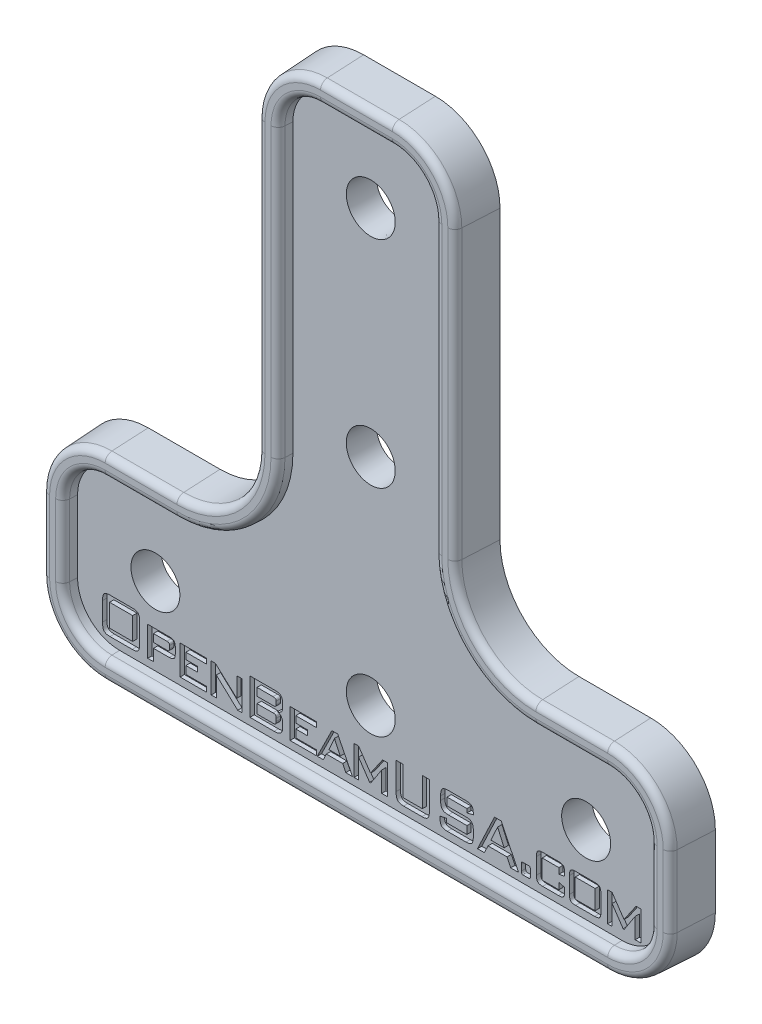
from build123d import *

# Parameters (mm, degrees)
BOSS_EXTRUDE1_DEPTH = 2
FILLET1_R           = 5
SKETCH2_R           = 1.6
CUT_EXTRUDE1_DEPTH  = 38.553295461
MOVE_FACE1_BY       = 0.5
MOVE_FACE1_2_BY     = 0.5
MOVE_FACE1_3_BY     = 0.5
MOVE_FACE1_4_BY     = 0.5
MOVE_FACE1_5_BY     = 0.5
MOVE_FACE1_6_BY     = 0.5
MOVE_FACE1_7_BY     = 0.5
MOVE_FACE1_8_BY     = 0.5
MOVE_FACE1_9_BY     = 0.5
MOVE_FACE1_10_BY    = 0.5
MOVE_FACE1_11_BY    = 0.5
MOVE_FACE1_12_BY    = 0.5
MOVE_FACE1_13_BY    = 0.5
MOVE_FACE1_14_BY    = 0.5
MOVE_FACE1_15_BY    = 0.5
MOVE_FACE1_16_BY    = 0.5
DRAFT1_ANGLE        = -3
BOSS_EXTRUDE3_DEPTH = 1
BOSS_EXTRUDE3_DRAFT = 3
FILLET3_R           = 0.5
CUT_EXTRUDE2_DEPTH  = 0.2
CUT_EXTRUDE2_DRAFT  = -3
SKETCH6_W           = 1.607142857
SKETCH6_H           = 1.5625
SKETCH6_W_2         = 1.383928571
SKETCH6_H_2         = 1.339285714
CUT_EXTRUDE3_DEPTH  = 0.3


with BuildPart() as part:
    # Sketch1 → Boss-Extrude1 (new body)
    with BuildSketch(Plane.XY):
        Polygon((-7.5, 30), (7.5, 30), (7.5, 0), (22.5, 0), (22.5, -15), (-22.5, -15), (-22.5, 0), (-7.5, 0), align=None)
    extrude(amount=BOSS_EXTRUDE1_DEPTH)

    # Fillet1
    fillet1_edges = [part.edges().sort_by_distance(p)[0] for p in [
        (22.5, -15, 1),
        (22.5, 0, 1),
        (-7.5, 0, 1),
        (7.5, 0, 1),
        (7.5, 30, 1),
        (-22.5, -15, 1),
        (-22.5, 0, 1),
        (-7.5, 30, 1),
    ]]
    fillet(fillet1_edges, radius=FILLET1_R)

    # Sketch2 → Cut-Extrude1 (cut, through all)
    with BuildSketch(Plane.XY.offset(2)):
        with Locations((-15, -7.5)):
            Circle(SKETCH2_R)
        with Locations((0, -7.5)):
            Circle(SKETCH2_R)
        with Locations((15, -7.5)):
            Circle(SKETCH2_R)
        with Locations((0, 22.5)):
            Circle(SKETCH2_R)
        with Locations((0, 7.5)):
            Circle(SKETCH2_R)
    extrude(amount=-CUT_EXTRUDE1_DEPTH, mode=Mode.SUBTRACT)

    # Move Face1: a curved face moved inward by 0.5
    add(Solid.thicken(part.faces().sort_by_distance((-8.964466094, 1.464466094, 1))[0], -MOVE_FACE1_BY), mode=Mode.SUBTRACT)

    # Move Face1 2: a face moved inward by 0.5
    extrude(part.faces().sort_by_distance((-15, 0, 1))[0], amount=MOVE_FACE1_2_BY, dir=(0, -1, 0), mode=Mode.SUBTRACT)

    # Move Face1 3: a curved face moved inward by 0.5
    add(Solid.thicken(part.faces().sort_by_distance((-21.035533906, -1.464466094, 1))[0], -MOVE_FACE1_3_BY), mode=Mode.SUBTRACT)

    # Move Face1 4: a face moved inward by 0.5
    extrude(part.faces().sort_by_distance((-22.5, -7.5, 1))[0], amount=MOVE_FACE1_4_BY, dir=(1, 0, 0), mode=Mode.SUBTRACT)

    # Move Face1 5: a curved face moved inward by 0.5
    add(Solid.thicken(part.faces().sort_by_distance((-21.035533906, -13.535533906, 1))[0], -MOVE_FACE1_5_BY), mode=Mode.SUBTRACT)

    # Move Face1 6: a face moved inward by 0.5
    extrude(part.faces().sort_by_distance((0, -15, 1))[0], amount=MOVE_FACE1_6_BY, dir=(0, 1, 0), mode=Mode.SUBTRACT)

    # Move Face1 7: a curved face moved inward by 0.5
    add(Solid.thicken(part.faces().sort_by_distance((21.035533906, -13.535533906, 1))[0], -MOVE_FACE1_7_BY), mode=Mode.SUBTRACT)

    # Move Face1 8: a face moved inward by 0.5
    extrude(part.faces().sort_by_distance((22.5, -7.5, 1))[0], amount=MOVE_FACE1_8_BY, dir=(-1, 0, 0), mode=Mode.SUBTRACT)

    # Move Face1 9: a curved face moved inward by 0.5
    add(Solid.thicken(part.faces().sort_by_distance((21.035533906, -1.464466094, 1))[0], -MOVE_FACE1_9_BY), mode=Mode.SUBTRACT)

    # Move Face1 10: a face moved inward by 0.5
    extrude(part.faces().sort_by_distance((15, 0, 1))[0], amount=MOVE_FACE1_10_BY, dir=(0, -1, 0), mode=Mode.SUBTRACT)

    # Move Face1 11: a curved face moved inward by 0.5
    add(Solid.thicken(part.faces().sort_by_distance((8.964466094, 1.464466094, 1))[0], -MOVE_FACE1_11_BY), mode=Mode.SUBTRACT)

    # Move Face1 12: a face moved inward by 0.5
    extrude(part.faces().sort_by_distance((7.5, 15, 1))[0], amount=MOVE_FACE1_12_BY, dir=(-1, 0, 0), mode=Mode.SUBTRACT)

    # Move Face1 13: a curved face moved inward by 0.5
    add(Solid.thicken(part.faces().sort_by_distance((6.035533906, 28.535533906, 1))[0], -MOVE_FACE1_13_BY), mode=Mode.SUBTRACT)

    # Move Face1 14: a face moved inward by 0.5
    extrude(part.faces().sort_by_distance((0, 30, 1))[0], amount=MOVE_FACE1_14_BY, dir=(0, -1, 0), mode=Mode.SUBTRACT)

    # Move Face1 15: a curved face moved inward by 0.5
    add(Solid.thicken(part.faces().sort_by_distance((-6.035533906, 28.535533906, 1))[0], -MOVE_FACE1_15_BY), mode=Mode.SUBTRACT)

    # Move Face1 16: a face moved inward by 0.5
    extrude(part.faces().sort_by_distance((-7.5, 15, 1))[0], amount=MOVE_FACE1_16_BY, dir=(1, 0, 0), mode=Mode.SUBTRACT)

    # Draft1
    draft1_faces = [part.faces().sort_by_distance(p)[0] for p in [
        (13.4, -7.5, 1),
        (-1.6, 22.5, 1),
        (-1.6, 7.5, 1),
        (-1.6, -7.5, 1),
        (-16.6, -7.5, 1),
        (-20.681980515, -1.818019485, 1),
        (-22, -7.5, 1),
        (-20.681980515, -13.181980515, 1),
        (0, -14.5, 1),
        (20.681980515, -13.181980515, 1),
        (22, -7.5, 1),
        (20.681980515, -1.818019485, 1),
        (15, -0.5, 1),
        (8.610912703, 1.110912703, 1),
        (7, 15, 1),
        (5.681980515, 28.181980515, 1),
        (0, 29.5, 1),
        (-5.681980515, 28.181980515, 1),
        (-7, 15, 1),
        (-8.610912703, 1.110912703, 1),
        (-15, -0.5, 1),
    ]]
    draft(draft1_faces, Plane(origin=(0, 0, 0), x_dir=(-1, 0, 0), z_dir=(0, 0, -1)), DRAFT1_ANGLE)


with BuildPart() as boss_extrude3_tool:
    # Sketch4 → Boss-Extrude3 (with draft: the straight prism first)
    with BuildSketch(Plane.XY.offset(2)):
        with BuildLine():
            Line((-17.5, -14.395184441), (17.5, -14.395184441))
            ThreePointArc((17.5, -14.395184441), (20.607864723, -13.107864723), (21.895184441, -10))
            Line((21.895184441, -10), (21.895184441, -5))
            ThreePointArc((21.895184441, -5), (20.607864723, -1.892135277), (17.5, -0.604815559))
            Line((17.5, -0.604815559), (12.5, -0.604815559))
            ThreePointArc((12.5, -0.604815559), (8.536796911, 1.036796911), (6.895184441, 5))
            Line((6.895184441, 5), (6.895184441, 25))
            ThreePointArc((6.895184441, 25), (5.607864723, 28.107864723), (2.5, 29.395184441))
            Line((2.5, 29.395184441), (-2.5, 29.395184441))
            ThreePointArc((-2.5, 29.395184441), (-5.607864723, 28.107864723), (-6.895184441, 25))
            Line((-6.895184441, 25), (-6.895184441, 5))
            ThreePointArc((-6.895184441, 5), (-8.536796911, 1.036796911), (-12.5, -0.604815559))
            Line((-12.5, -0.604815559), (-17.5, -0.604815559))
            ThreePointArc((-17.5, -0.604815559), (-20.607864723, -1.892135277), (-21.895184441, -5))
            Line((-21.895184441, -5), (-21.895184441, -10))
            ThreePointArc((-21.895184441, -10), (-20.607864723, -13.107864723), (-17.5, -14.395184441))
        make_face()
        with BuildLine():
            Line((-17.5, -12.921388331), (17.5, -12.921388331))
            ThreePointArc((17.5, -12.921388331), (19.565733499, -12.065733499), (20.421388331, -10))
            Line((20.421388331, -10), (20.421388331, -5))
            ThreePointArc((20.421388331, -5), (19.565733499, -2.934266501), (17.5, -2.078611669))
            Line((17.5, -2.078611669), (12.5, -2.078611669))
            ThreePointArc((12.5, -2.078611669), (7.494665688, -0.005334312), (5.421388331, 5))
            Line((5.421388331, 5), (5.421388331, 25))
            ThreePointArc((5.421388331, 25), (4.565733499, 27.065733499), (2.5, 27.921388331))
            Line((2.5, 27.921388331), (-2.5, 27.921388331))
            ThreePointArc((-2.5, 27.921388331), (-4.565733499, 27.065733499), (-5.421388331, 25))
            Line((-5.421388331, 25), (-5.421388331, 5))
            ThreePointArc((-5.421388331, 5), (-7.494665688, -0.005334312), (-12.5, -2.078611669))
            Line((-12.5, -2.078611669), (-17.5, -2.078611669))
            ThreePointArc((-17.5, -2.078611669), (-19.565733499, -2.934266501), (-20.421388331, -5))
            Line((-20.421388331, -5), (-20.421388331, -10))
            ThreePointArc((-20.421388331, -10), (-19.565733499, -12.065733499), (-17.5, -12.921388331))
        make_face(mode=Mode.SUBTRACT)
    extrude(amount=BOSS_EXTRUDE3_DEPTH)
    # Boss-Extrude3: the draft: its side faces are tilted about the plane it starts from
    boss_extrude3_sides = [boss_extrude3_tool.faces().sort_by_distance(p)[0] for p in [
        (-20.607864723, -1.892135277, 2.5),
        (-21.895184441, -7.5, 2.5),
        (-20.607864723, -13.107864723, 2.5),
        (0, -14.395184441, 2.5),
        (20.607864723, -13.107864723, 2.5),
        (21.895184441, -7.5, 2.5),
        (20.607864723, -1.892135277, 2.5),
        (15, -0.604815559, 2.5),
        (8.536796911, 1.036796911, 2.5),
        (6.895184441, 15, 2.5),
        (5.607864723, 28.107864723, 2.5),
        (0, 29.395184441, 2.5),
        (-5.607864723, 28.107864723, 2.5),
        (-6.895184441, 15, 2.5),
        (-8.536796911, 1.036796911, 2.5),
        (-15, -0.604815559, 2.5),
        (-15, -2.078611669, 2.5),
        (-7.494665688, -0.005334312, 2.5),
        (-5.421388331, 15, 2.5),
        (-4.565733499, 27.065733499, 2.5),
        (0, 27.921388331, 2.5),
        (4.565733499, 27.065733499, 2.5),
        (5.421388331, 15, 2.5),
        (7.494665688, -0.005334312, 2.5),
        (15, -2.078611669, 2.5),
        (19.565733499, -2.934266501, 2.5),
        (20.421388331, -7.5, 2.5),
        (19.565733499, -12.065733499, 2.5),
        (0, -12.921388331, 2.5),
        (-19.565733499, -12.065733499, 2.5),
        (-20.421388331, -7.5, 2.5),
        (-19.565733499, -2.934266501, 2.5),
    ]]
    draft(boss_extrude3_sides, Plane.XY.offset(2), BOSS_EXTRUDE3_DRAFT)


with BuildPart() as part_1:
    add(part.part)

    # Boss-Extrude3: add boss_extrude3_tool
    add(boss_extrude3_tool.part)

    # Fillet3
    fillet3_edges = [part_1.edges().sort_by_distance(p)[0] for p in [
        (-7.531723584, 0.031723584, 3),
        (-5.47379611, 15, 3),
        (-4.602791396, 27.102791396, 3),
        (0, 27.97379611, 3),
        (4.602791396, 27.102791396, 3),
        (5.47379611, 15, 3),
        (7.531723584, 0.031723584, 3),
        (15, -2.02620389, 3),
        (19.602791396, -2.897208604, 3),
        (20.47379611, -7.5, 3),
        (19.602791396, -12.102791396, 3),
        (0, -12.97379611, 3),
        (-19.602791396, -12.102791396, 3),
        (-20.47379611, -7.5, 3),
        (-19.602791396, -2.897208604, 3),
        (-8.499739015, 0.999739015, 3),
        (-6.842776662, 15, 3),
        (-5.570806827, 28.070806827, 3),
        (0, 29.342776662, 3),
        (5.570806827, 28.070806827, 3),
        (6.842776662, 15, 3),
        (8.499739015, 0.999739015, 3),
        (15, -0.657223338, 3),
        (20.570806827, -1.929193173, 3),
        (21.842776662, -7.5, 3),
        (20.570806827, -13.070806827, 3),
        (0, -14.342776662, 3),
        (-20.570806827, -13.070806827, 3),
        (-21.842776662, -7.5, 3),
        (-20.570806827, -1.929193173, 3),
        (-15, -2.02620389, 3),
        (-15, -0.657223338, 3),
    ]]
    fillet(fillet3_edges, radius=FILLET3_R)


with BuildPart() as cut_extrude2_tool:
    # Sketch5 → Cut-Extrude2 (with draft: the straight prism first)
    with BuildSketch(Plane(origin=(0, 0, 0), x_dir=(-1, 0, 0), z_dir=(0, 0, -1))):
        with BuildLine():
            Line((-14.5, -13.8), (14.5, -13.8))
            ThreePointArc((14.5, -13.8), (14.853553391, -13.653553391), (15, -13.3))
            Line((15, -13.3), (15, -10.3))
            ThreePointArc((15, -10.3), (14.853553391, -9.946446609), (14.5, -9.8))
            Line((14.5, -9.8), (-14.5, -9.8))
            ThreePointArc((-14.5, -9.8), (-14.853553391, -9.946446609), (-15, -10.3))
            Line((-15, -10.3), (-15, -13.3))
            ThreePointArc((-15, -13.3), (-14.853553391, -13.653553391), (-14.5, -13.8))
        make_face()
    extrude(amount=-CUT_EXTRUDE2_DEPTH)
    # Cut-Extrude2: the draft: its side faces are tilted about the plane it starts from
    cut_extrude2_sides = [cut_extrude2_tool.faces().sort_by_distance(p)[0] for p in [
        (0, -13.8, 0.1),
        (-14.853553391, -13.653553391, 0.1),
        (-15, -11.8, 0.1),
        (-14.853553391, -9.946446609, 0.1),
        (0, -9.8, 0.1),
        (14.853553391, -9.946446609, 0.1),
        (15, -11.8, 0.1),
        (14.853553391, -13.653553391, 0.1),
    ]]
    draft(cut_extrude2_sides, Plane(origin=(0, 0, 0), x_dir=(-1, 0, 0), z_dir=(0, 0, -1)), CUT_EXTRUDE2_DRAFT)


with BuildPart() as part_2:
    add(part_1.part)

    # Cut-Extrude2: cut by cut_extrude2_tool
    add(cut_extrude2_tool.part, mode=Mode.SUBTRACT)

    # Sketch6 → Cut-Extrude3 (cut)
    # profile 1 of 15: a face of its own
    with BuildSketch(Plane.XY.offset(2)):
        with BuildLine():
            add(Edge.make_bspline(
                [(-18.683035714, -10.51011601), (-18.682938002, -10.482896819), (-18.682750693, -10.430719031), (-18.676668044, -10.356042819), (-18.668860697, -10.287926096), (-18.656684431, -10.226526586), (-18.643031263, -10.171215857), (-18.623628363, -10.123356935), (-18.602261682, -10.081592118), (-18.57683028, -10.045679654), (-18.545847467, -10.01549167), (-18.508789269, -9.990400409), (-18.46597857, -9.968617372), (-18.416580048, -9.951568957), (-18.361320255, -9.937537726), (-18.299893333, -9.928095322), (-18.232289845, -9.922620499), (-18.185232384, -9.921811984), (-18.160574777, -9.921388331)],
                knots=[0, 0, 0, 0, 1.403573437, 2.690578007, 3.862923789, 4.937964027, 5.918444779, 6.796020214, 7.595440406, 8.334448064, 9.055422419, 9.814027648, 10.634759978, 11.526322857, 12.50379092, 13.57259004, 14.728063101, 16, 16, 16, 16], degree=3))
            Line((-18.160574777, -9.921388331), (-16.618303571, -9.921388331))
            add(Edge.make_bspline(
                [(-16.618303571, -9.921388331), (-16.593646851, -9.921821445), (-16.546359359, -9.922652086), (-16.47851397, -9.928042886), (-16.416866585, -9.937552288), (-16.361581808, -9.951531158), (-16.312067564, -9.968807094), (-16.268818434, -9.990195221), (-16.231663242, -10.015520924), (-16.200589368, -10.045644028), (-16.175401388, -10.081803336), (-16.152770043, -10.122971899), (-16.134936302, -10.1715459), (-16.119750579, -10.226353255), (-16.108035577, -10.28796068), (-16.100083866, -10.356032245), (-16.094044728, -10.430722068), (-16.09385104, -10.48289786), (-16.09375, -10.51011601)],
                knots=[0, 0, 0, 0, 1.269785572, 2.435237667, 3.502229043, 4.478043838, 5.368098746, 6.198135559, 6.9554577, 7.675212615, 8.41297033, 9.216677895, 10.088421144, 11.070387939, 12.143609877, 13.313972779, 14.598800537, 16, 16, 16, 16], degree=3))
            Line((-16.09375, -10.51011601), (-16.09375, -11.811036769))
            add(Edge.make_bspline(
                [(-16.09375, -11.811036769), (-16.093842278, -11.839417739), (-16.09401872, -11.893684241), (-16.100160957, -11.971615929), (-16.107923834, -12.042494992), (-16.119768025, -12.106636793), (-16.134983627, -12.163512713), (-16.152647685, -12.213987832), (-16.175226782, -12.256626432), (-16.200584268, -12.293600425), (-16.231614851, -12.324447097), (-16.268765478, -12.35050105), (-16.312034652, -12.372539497), (-16.361440049, -12.390711436), (-16.416882029, -12.404519647), (-16.478547615, -12.413833116), (-16.546317858, -12.420380788), (-16.593639586, -12.421043123), (-16.618303571, -12.421388331)],
                knots=[0, 0, 0, 0, 1.431764632, 2.737639174, 3.942781974, 5.02906717, 6.025299976, 6.912532689, 7.72083079, 8.453349384, 9.16691991, 9.91579719, 10.734504626, 11.610727997, 12.566975227, 13.612570717, 14.755676853, 16, 16, 16, 16], degree=3))
            Line((-16.618303571, -12.421388331), (-18.160574777, -12.421388331))
            add(Edge.make_bspline(
                [(-18.160574777, -12.421388331), (-18.185239843, -12.421053786), (-18.232332055, -12.420415051), (-18.299858951, -12.413778337), (-18.36130513, -12.404534983), (-18.416721056, -12.39067324), (-18.466016648, -12.372733543), (-18.508837175, -12.350292386), (-18.545896228, -12.324476536), (-18.576835987, -12.293565989), (-18.602437267, -12.256831275), (-18.623739569, -12.213611433), (-18.642993476, -12.163833364), (-18.656664691, -12.106469119), (-18.668974999, -12.042529082), (-18.676590443, -11.971605588), (-18.682776858, -11.893687213), (-18.682946824, -11.83941876), (-18.683035714, -11.811036769)],
                knots=[0, 0, 0, 0, 1.246375741, 2.37966474, 3.42698501, 4.384809634, 5.262478393, 6.072109836, 6.82222244, 7.536970048, 8.27069698, 9.074935671, 9.967741802, 10.962637047, 12.050714143, 13.257844907, 14.565873577, 16, 16, 16, 16], degree=3))
            Line((-18.683035714, -11.811036769), (-18.683035714, -10.51011601))
        make_face()
        with Locations((-17.388392858, -11.149066903)):
            Rectangle(SKETCH6_W, SKETCH6_H, mode=Mode.SUBTRACT)
    # profile 2 of 15: a face of its own
    with BuildSketch(Plane.XY.offset(2)):
        with BuildLine():
            Line((-15.535714286, -12.421388331), (-15.535714286, -10.367816903))
            Line((-15.535714286, -10.367816903), (-14.029715402, -10.367816903))
            add(Edge.make_bspline(
                [(-14.029715402, -10.367816903), (-13.995423097, -10.368539056), (-13.931618582, -10.369882701), (-13.843548193, -10.388389773), (-13.76975323, -10.416602804), (-13.710808728, -10.459570634), (-13.666606985, -10.516609772), (-13.63694694, -10.588263693), (-13.619168575, -10.67387452), (-13.617150642, -10.735791272), (-13.616071429, -10.768905072)],
                knots=[0, 0, 0, 0, 1.229947315, 2.288449038, 3.21776736, 4.048244043, 4.875520742, 5.777278643, 6.811262717, 8, 8, 8, 8], degree=3))
            Line((-13.616071429, -10.768905072), (-13.616071429, -11.216728733))
            add(Edge.make_bspline(
                [(-13.616071429, -11.216728733), (-13.61713941, -11.249840567), (-13.619129003, -11.311526162), (-13.637004149, -11.397243648), (-13.667259143, -11.468686782), (-13.711509006, -11.52635012), (-13.770938209, -11.568616699), (-13.844372756, -11.597454165), (-13.932113653, -11.615653184), (-13.995666115, -11.617062069), (-14.029715402, -11.617816903)],
                knots=[0, 0, 0, 0, 1.189703839, 2.216355318, 3.129857055, 3.957806409, 4.795702339, 5.718039216, 6.7774016, 8, 8, 8, 8], degree=3))
            Line((-14.029715402, -11.617816903), (-15.133928571, -11.617816903))
            Line((-15.133928571, -11.617816903), (-15.133928571, -12.421388331))
            Line((-15.133928571, -12.421388331), (-15.535714286, -12.421388331))
        make_face()
        with BuildLine():
            Line((-14.203404018, -10.72495976), (-15.133928571, -10.72495976))
            Line((-15.133928571, -10.72495976), (-15.133928571, -11.260674045))
            Line((-15.133928571, -11.260674045), (-14.203404018, -11.260674045))
            add(Edge.make_bspline(
                [(-14.203404018, -11.260674045), (-14.187098835, -11.260411914), (-14.157096885, -11.259929586), (-14.115874448, -11.253123203), (-14.082698889, -11.241865943), (-14.056496441, -11.22503593), (-14.038862603, -11.201230006), (-14.025790126, -11.172314024), (-14.019621299, -11.136752914), (-14.018473493, -11.11118051), (-14.017857143, -11.097448599)],
                knots=[0, 0, 0, 0, 1.352116432, 2.487928597, 3.45245427, 4.244622693, 5.028283095, 5.874769735, 6.858790467, 8, 8, 8, 8], degree=3))
            Line((-14.017857143, -11.097448599), (-14.017857143, -10.888185206))
            add(Edge.make_bspline(
                [(-14.017857143, -10.888185206), (-14.018466943, -10.874447349), (-14.01960255, -10.848863871), (-14.025849613, -10.813373783), (-14.038604854, -10.784405633), (-14.05696494, -10.76134583), (-14.082395639, -10.743581231), (-14.115935147, -10.732589069), (-14.157077073, -10.725678609), (-14.187091859, -10.725212873), (-14.203404018, -10.72495976)],
                knots=[0, 0, 0, 0, 1.141800926, 2.126331593, 2.973256896, 3.742199929, 4.545756613, 5.510782118, 6.64718288, 8, 8, 8, 8], degree=3))
        make_face(mode=Mode.SUBTRACT)
    # profile 3 of 15: a face of its own
    with BuildSketch(Plane.XY.offset(2)):
        Polygon((-13.28125, -12.421388331), (-13.28125, -10.367816903), (-11.450892857, -10.367816903), (-11.450892857, -10.72495976), (-12.879464286, -10.72495976), (-12.879464286, -11.171388331), (-12.075892857, -11.171388331), (-12.075892857, -11.528531188), (-12.879464286, -11.528531188), (-12.879464286, -12.064245474), (-11.450892857, -12.064245474), (-11.450892857, -12.421388331), align=None)
    # profile 4 of 15: a face of its own
    with BuildSketch(Plane.XY.offset(2)):
        Polygon((-11.116071429, -12.421388331), (-11.116071429, -10.367816903), (-10.821707589, -10.367816903), (-9.330357143, -11.731516679), (-9.330357143, -10.367816903), (-8.973214286, -10.367816903), (-8.973214286, -12.421388331), (-9.269670759, -12.421388331), (-10.758928571, -11.036762215), (-10.758928571, -12.421388331), align=None)
    # profile 5 of 15: a face of its own
    with BuildSketch(Plane.XY.offset(2)):
        with BuildLine():
            Line((-8.415178571, -12.421388331), (-8.415178571, -9.921388331))
            Line((-8.415178571, -9.921388331), (-6.604352679, -9.921388331))
            add(Edge.make_bspline(
                [(-6.604352679, -9.921388331), (-6.584578843, -9.921834875), (-6.546344475, -9.922698306), (-6.490993159, -9.928039701), (-6.439967327, -9.937982556), (-6.392984602, -9.950745963), (-6.350485334, -9.96859511), (-6.312122888, -9.989884555), (-6.278270641, -10.015636971), (-6.247499297, -10.044225626), (-6.221859971, -10.078333565), (-6.199342826, -10.116212883), (-6.180626562, -10.158719559), (-6.16430305, -10.205449169), (-6.152784019, -10.257462736), (-6.1448266, -10.313921043), (-6.13872257, -10.37466268), (-6.138505034, -10.416628349), (-6.138392857, -10.438268911)],
                knots=[0, 0, 0, 0, 1.179053587, 2.27979888, 3.310209753, 4.275627239, 5.176695408, 6.051906754, 6.883661987, 7.707291014, 8.547436998, 9.417583548, 10.329674368, 11.311670144, 12.364223081, 13.499348066, 14.710481303, 16, 16, 16, 16], degree=3))
            Line((-6.138392857, -10.438268911), (-6.138392857, -10.712403956))
            add(Edge.make_bspline(
                [(-6.138392857, -10.712403956), (-6.139201585, -10.740664602), (-6.140751158, -10.794813763), (-6.159801787, -10.871364096), (-6.188653758, -10.939999278), (-6.231476997, -10.9984646), (-6.284875183, -11.04779488), (-6.349361396, -11.086101447), (-6.424010981, -11.11446387), (-6.477873721, -11.124365422), (-6.505998884, -11.129535653)],
                knots=[0, 0, 0, 0, 1.098733523, 2.105242008, 3.054667811, 3.982622784, 4.906010345, 5.869427447, 6.887492557, 8, 8, 8, 8], degree=3))
            add(Edge.make_bspline(
                [(-6.505998884, -11.129535653), (-6.478036354, -11.135503517), (-6.424069928, -11.147021228), (-6.349494996, -11.180530422), (-6.285840082, -11.227562783), (-6.231981261, -11.286146859), (-6.190215279, -11.356411535), (-6.158931917, -11.436113578), (-6.142041656, -11.526206522), (-6.139644104, -11.589151907), (-6.138392857, -11.62200217)],
                knots=[0, 0, 0, 0, 1.013460027, 1.955932307, 2.877588656, 3.806945104, 4.76292404, 5.764334755, 6.833239427, 8, 8, 8, 8], degree=3))
            Line((-6.138392857, -11.62200217), (-6.138392857, -11.935199715))
            add(Edge.make_bspline(
                [(-6.138392857, -11.935199715), (-6.138719134, -11.95521589), (-6.1393511, -11.993985259), (-6.146352988, -12.050089823), (-6.158290901, -12.101885834), (-6.174184983, -12.150022339), (-6.195462804, -12.19402501), (-6.220131016, -12.234909748), (-6.250938229, -12.270878361), (-6.285794672, -12.303013122), (-6.32562112, -12.331371608), (-6.370173139, -12.355556185), (-6.41960395, -12.375811734), (-6.47355595, -12.392422759), (-6.532276629, -12.405800235), (-6.595779264, -12.414401622), (-6.66400309, -12.420183393), (-6.71106383, -12.420976607), (-6.735491071, -12.421388331)],
                knots=[0, 0, 0, 0, 1.08782081, 2.107002258, 3.066832627, 3.974287218, 4.856380914, 5.719335199, 6.562621095, 7.421491684, 8.291454475, 9.213583009, 10.171413382, 11.190986747, 12.279688622, 13.441734262, 14.672112383, 16, 16, 16, 16], degree=3))
            Line((-6.735491071, -12.421388331), (-8.415178571, -12.421388331))
        make_face()
        with BuildLine():
            Line((-6.809430804, -10.367816903), (-7.924107143, -10.367816903))
            Line((-7.924107143, -10.367816903), (-7.924107143, -10.903531188))
            Line((-7.924107143, -10.903531188), (-6.809430804, -10.903531188))
            add(Edge.make_bspline(
                [(-6.809430804, -10.903531188), (-6.789868986, -10.903287406), (-6.753850642, -10.902838541), (-6.704705771, -10.895868934), (-6.664727575, -10.885532078), (-6.633451466, -10.869144346), (-6.610525171, -10.846199776), (-6.594844818, -10.816925235), (-6.585991347, -10.781273052), (-6.585228551, -10.755471654), (-6.584821429, -10.741700831)],
                knots=[0, 0, 0, 0, 1.458061766, 2.684667078, 3.694961047, 4.525618309, 5.286113602, 6.078010599, 6.974188284, 8, 8, 8, 8], degree=3))
            Line((-6.584821429, -10.741700831), (-6.584821429, -10.52964726))
            add(Edge.make_bspline(
                [(-6.584821429, -10.52964726), (-6.585215601, -10.516102183), (-6.585953486, -10.490746024), (-6.594997769, -10.455637651), (-6.610492176, -10.426504554), (-6.633624093, -10.40365479), (-6.664600507, -10.386469448), (-6.704601516, -10.375280427), (-6.753863487, -10.36857796), (-6.789873506, -10.368084762), (-6.809430804, -10.367816903)],
                knots=[0, 0, 0, 0, 1.011123078, 1.892805606, 2.686758123, 3.449227428, 4.290532683, 5.308364354, 6.538153555, 8, 8, 8, 8], degree=3))
        make_face(mode=Mode.SUBTRACT)
        with BuildLine():
            Line((-6.809430804, -11.34995976), (-7.924107143, -11.34995976))
            Line((-7.924107143, -11.34995976), (-7.924107143, -11.97495976))
            Line((-7.924107143, -11.97495976), (-6.809430804, -11.97495976))
            add(Edge.make_bspline(
                [(-6.809430804, -11.97495976), (-6.78912971, -11.974729537), (-6.751959866, -11.974308016), (-6.701848603, -11.964050408), (-6.661008099, -11.950556293), (-6.630050641, -11.927619568), (-6.609123919, -11.895827935), (-6.594863374, -11.856463039), (-6.585878103, -11.808409349), (-6.585191715, -11.773414396), (-6.584821429, -11.754535653)],
                knots=[0, 0, 0, 0, 1.312342557, 2.402804986, 3.304020979, 4.078546667, 4.847629795, 5.734752509, 6.777965855, 8, 8, 8, 8], degree=3))
            Line((-6.584821429, -11.754535653), (-6.584821429, -11.568291233))
            add(Edge.make_bspline(
                [(-6.584821429, -11.568291233), (-6.585200764, -11.549416114), (-6.585903926, -11.514427881), (-6.594743125, -11.466546068), (-6.609130884, -11.427679287), (-6.630070466, -11.396444881), (-6.661397726, -11.374656265), (-6.701546197, -11.359680216), (-6.752105393, -11.35100656), (-6.789165763, -11.350329813), (-6.809430804, -11.34995976)],
                knots=[0, 0, 0, 0, 1.227068129, 2.274578833, 3.151237288, 3.911086288, 4.679771909, 5.590123259, 6.682251448, 8, 8, 8, 8], degree=3))
        make_face(mode=Mode.SUBTRACT)
    # profile 6 of 15: a face of its own
    with BuildSketch(Plane.XY.offset(2)):
        Polygon((-5.625, -12.421388331), (-5.625, -10.367816903), (-3.794642857, -10.367816903), (-3.794642857, -10.72495976), (-5.223214286, -10.72495976), (-5.223214286, -11.171388331), (-4.419642857, -11.171388331), (-4.419642857, -11.528531188), (-5.223214286, -11.528531188), (-5.223214286, -12.064245474), (-3.794642857, -12.064245474), (-3.794642857, -12.421388331), align=None)
    # profile 7 of 15: a face of its own
    with BuildSketch(Plane.XY.offset(2)):
        Polygon((-3.727678571, -12.421388331), (-2.709263393, -10.367816903), (-2.306780134, -10.367816903), (-1.272321429, -12.421388331), (-1.741768973, -12.421388331), (-1.958007812, -11.97495976), (-3.093610491, -11.97495976), (-3.30984933, -12.421388331), align=None)
        Polygon((-2.915039062, -11.617816903), (-2.128208705, -11.617816903), (-2.52859933, -10.746583644), align=None, mode=Mode.SUBTRACT)
    # profile 8 of 15: a face of its own
    with BuildSketch(Plane.XY.offset(2)):
        Polygon((-1.160714286, -12.421388331), (-1.160714286, -10.367816903), (-0.848214286, -10.367816903), (-0.017438616, -11.586427394), (0.822405134, -10.367816903), (1.160714286, -10.367816903), (1.160714286, -12.421388331), (0.758928571, -12.421388331), (0.758928571, -11.008162885), (0.000697545, -12.174457528), (-0.080217634, -12.174457528), (-0.848214286, -11.040947483), (-0.848214286, -12.421388331), align=None)
    # profile 9 of 15: a face of its own
    with BuildSketch(Plane.XY.offset(2)):
        with BuildLine():
            Line((2.254464286, -9.921388331), (2.254464286, -11.930316903))
            Line((2.254464286, -11.930316903), (3.59375, -11.930316903))
            Line((3.59375, -11.930316903), (3.59375, -9.921388331))
            Line((3.59375, -9.921388331), (4.084821429, -9.921388331))
            Line((4.084821429, -9.921388331), (4.084821429, -11.811036769))
            add(Edge.make_bspline(
                [(4.084821429, -11.811036769), (4.084729151, -11.83941774), (4.08455271, -11.893684242), (4.078410469, -11.971615924), (4.070647603, -12.042495008), (4.058803376, -12.106636741), (4.043587889, -12.163512882), (4.025923466, -12.213987296), (4.003345545, -12.256628171), (3.977984177, -12.293594652), (3.946967658, -12.32446853), (3.909930317, -12.35029481), (3.867103299, -12.37273261), (3.817809766, -12.390674382), (3.762392801, -12.404530974), (3.700719574, -12.413829665), (3.632951625, -12.420381775), (3.585629562, -12.421043461), (3.560965402, -12.421388331)],
                knots=[0, 0, 0, 0, 1.432696721, 2.739421396, 3.945348753, 5.032341128, 6.029222489, 6.917032796, 7.725857105, 8.458852573, 9.172887639, 9.922252443, 10.731076752, 11.60787055, 12.564740304, 13.611016484, 14.75486679, 16, 16, 16, 16], degree=3))
            Line((3.560965402, -12.421388331), (2.28515625, -12.421388331))
            add(Edge.make_bspline(
                [(2.28515625, -12.421388331), (2.260725019, -12.421041479), (2.213867868, -12.420376245), (2.146787965, -12.413857345), (2.085611417, -12.404422129), (2.030586419, -12.390821903), (1.981612193, -12.372601766), (1.938902995, -12.350085944), (1.901310533, -12.324703811), (1.870249293, -12.29356777), (1.844862961, -12.25663627), (1.822292601, -12.2139848), (1.804625834, -12.16351367), (1.789411083, -12.106636498), (1.777566629, -12.042495084), (1.769803833, -11.971615901), (1.763661571, -11.893684249), (1.763485133, -11.839417742), (1.763392857, -11.811036769)],
                knots=[0, 0, 0, 0, 1.23621022, 2.370952548, 3.407995083, 4.367048021, 5.234819768, 6.045489481, 6.806183598, 7.521847799, 8.256515662, 9.067185375, 9.957021301, 10.956177136, 12.045649581, 13.254328369, 14.564034454, 16, 16, 16, 16], degree=3))
            Line((1.763392857, -11.811036769), (1.763392857, -9.921388331))
            Line((1.763392857, -9.921388331), (2.254464286, -9.921388331))
        make_face()
    # profile 10 of 15: a face of its own
    with BuildSketch(Plane.XY.offset(2)):
        with BuildLine():
            Line((6.696428571, -10.367816903), (5.3125, -10.367816903))
            Line((5.3125, -10.367816903), (5.3125, -10.903531188))
            Line((5.3125, -10.903531188), (6.63016183, -10.903531188))
            add(Edge.make_bspline(
                [(6.63016183, -10.903531188), (6.654353014, -10.903958949), (6.700479225, -10.904774577), (6.766713326, -10.910183332), (6.826905144, -10.919870583), (6.881304458, -10.93330079), (6.92929363, -10.951844001), (6.971690494, -10.973066465), (7.007619207, -10.999097146), (7.038065694, -11.029410299), (7.063642091, -11.06526319), (7.084974932, -11.107481732), (7.103195036, -11.156136605), (7.117397219, -11.211638562), (7.129343814, -11.273803544), (7.137366908, -11.3428083), (7.142315022, -11.418477621), (7.142671297, -11.471091459), (7.142857143, -11.498536769)],
                knots=[0, 0, 0, 0, 1.251664019, 2.386593346, 3.434812074, 4.403525499, 5.279339231, 6.091802716, 6.849802477, 7.564361493, 8.305564064, 9.118027549, 10.005088541, 10.988481401, 12.078528828, 13.278238635, 14.580229349, 16, 16, 16, 16], degree=3))
            Line((7.142857143, -11.498536769), (7.142857143, -11.820802394))
            add(Edge.make_bspline(
                [(7.142857143, -11.820802394), (7.142670907, -11.848480082), (7.142313758, -11.90155824), (7.137365743, -11.977924663), (7.1293358, -12.047622044), (7.117402599, -12.110490083), (7.103150126, -12.166658376), (7.085162413, -12.215888413), (7.063443653, -12.258367141), (7.038074605, -12.294750102), (7.0078556, -12.325841034), (6.971643631, -12.351775421), (6.929450865, -12.373242409), (6.881137779, -12.390741413), (6.826858606, -12.40421072), (6.766788679, -12.414980112), (6.70046859, -12.42007351), (6.654349355, -12.420935995), (6.63016183, -12.421388331)],
                knots=[0, 0, 0, 0, 1.424071459, 2.730975543, 3.936089492, 5.032008831, 6.021662612, 6.915142695, 7.723221153, 8.470166276, 9.189379185, 9.94328787, 10.751366328, 11.61825191, 12.581736995, 13.626287574, 14.755091461, 16, 16, 16, 16], degree=3))
            Line((6.63016183, -12.421388331), (5.324358259, -12.421388331))
            add(Edge.make_bspline(
                [(5.324358259, -12.421388331), (5.300866876, -12.420931359), (5.255674503, -12.420052242), (5.190533843, -12.414925726), (5.131530179, -12.404487117), (5.078393092, -12.390307101), (5.030932807, -12.373619972), (4.989668753, -12.35157881), (4.954294363, -12.325618915), (4.924073733, -12.294956748), (4.899449082, -12.258298175), (4.878544743, -12.215717937), (4.860436506, -12.166672042), (4.845991982, -12.110563995), (4.835216036, -12.047531968), (4.826837919, -11.97793932), (4.821995382, -11.901554055), (4.821622836, -11.848478648), (4.821428571, -11.820802394)],
                knots=[0, 0, 0, 0, 1.219667072, 2.346377425, 3.388230707, 4.325160294, 5.199674189, 5.993493179, 6.744299279, 7.46984103, 8.21646325, 9.026182912, 9.927525331, 10.925887746, 12.029274189, 13.244992753, 14.563397171, 16, 16, 16, 16], degree=3))
            Line((4.821428571, -11.820802394), (4.821428571, -11.75872092))
            Line((4.821428571, -11.75872092), (5.267857143, -11.66245976))
            Line((5.267857143, -11.66245976), (5.267857143, -11.930316903))
            Line((5.267857143, -11.930316903), (6.696428571, -11.930316903))
            Line((6.696428571, -11.930316903), (6.696428571, -11.394602617))
            Line((6.696428571, -11.394602617), (5.406668527, -11.394602617))
            add(Edge.make_bspline(
                [(5.406668527, -11.394602617), (5.381318621, -11.394142187), (5.332646449, -11.393258156), (5.262625271, -11.38820715), (5.199039968, -11.377517598), (5.141836488, -11.363824902), (5.090670769, -11.346784404), (5.046603427, -11.324170198), (5.008215836, -11.298389637), (4.97572848, -11.267778264), (4.949636871, -11.230568829), (4.926561464, -11.188113753), (4.907738712, -11.138304217), (4.89305814, -11.081840424), (4.880014688, -11.018833425), (4.872516201, -10.948772379), (4.866340152, -10.872018433), (4.86616349, -10.818446253), (4.866071429, -10.790528956)],
                knots=[0, 0, 0, 0, 1.269118906, 2.436725934, 3.510156791, 4.492522834, 5.379601377, 6.202018549, 6.963898946, 7.688320218, 8.421662355, 9.228867506, 10.102094215, 11.078998209, 12.147242463, 13.319481032, 14.603139802, 16, 16, 16, 16], degree=3))
            Line((4.866071429, -10.790528956), (4.866071429, -10.512906188))
            add(Edge.make_bspline(
                [(4.866071429, -10.512906188), (4.866168727, -10.485686466), (4.866356072, -10.43327569), (4.872507781, -10.358146186), (4.880016723, -10.289478223), (4.89301151, -10.227844707), (4.907893802, -10.172615002), (4.926346791, -10.123783283), (4.949852356, -10.082499353), (4.975700358, -10.04602468), (5.008481655, -10.016282414), (5.046389433, -9.990260801), (5.090887408, -9.968693775), (5.141807749, -9.951449339), (5.198979833, -9.937581032), (5.262701901, -9.928047641), (5.332635014, -9.922656793), (5.381314705, -9.921822734), (5.406668527, -9.921388331)],
                knots=[0, 0, 0, 0, 1.377632593, 2.652591195, 3.814954431, 4.872421982, 5.83787301, 6.710181857, 7.506051987, 8.238342604, 8.963022824, 9.733676968, 10.56030012, 11.457594181, 12.451273063, 13.535212947, 14.716266034, 16, 16, 16, 16], degree=3))
            Line((5.406668527, -9.921388331), (6.606445313, -9.921388331))
            add(Edge.make_bspline(
                [(6.606445313, -9.921388331), (6.630871508, -9.921807846), (6.677930234, -9.92261607), (6.745479683, -9.928236239), (6.807133727, -9.936888325), (6.862778268, -9.950065049), (6.91249593, -9.967560204), (6.956687775, -9.988232319), (6.995178384, -10.012838845), (7.027760105, -10.041925314), (7.055736906, -10.075759055), (7.07966266, -10.115155119), (7.098382083, -10.160900236), (7.115935242, -10.211649019), (7.127570867, -10.2686675), (7.13703729, -10.331263883), (7.141354413, -10.399846619), (7.142342132, -10.447566677), (7.142857143, -10.472448599)],
                knots=[0, 0, 0, 0, 1.296779316, 2.498333482, 3.59650498, 4.599589076, 5.528850417, 6.390279385, 7.1847031, 7.945414428, 8.699384315, 9.508162524, 10.381888205, 11.318826147, 12.355238386, 13.465624049, 14.678540085, 16, 16, 16, 16], degree=3))
            Line((7.142857143, -10.472448599), (7.142857143, -10.521974269))
            Line((7.142857143, -10.521974269), (6.696428571, -10.635674045))
            Line((6.696428571, -10.635674045), (6.696428571, -10.367816903))
        make_face()
    # profile 11 of 15: a face of its own
    with BuildSketch(Plane.XY.offset(2)):
        Polygon((7.433035714, -12.421388331), (8.618861607, -9.921388331), (9.088309152, -9.921388331), (10.290178571, -12.421388331), (9.742606027, -12.421388331), (9.490792411, -11.885674045), (8.162667411, -11.885674045), (7.918526786, -12.421388331), align=None)
        Polygon((8.370535714, -11.439245474), (9.289202009, -11.439245474), (8.836495536, -10.41106467), align=None, mode=Mode.SUBTRACT)
    # profile 12 of 15: a face of its own
    with BuildSketch(Plane.XY.offset(2)):
        with BuildLine():
            Line((10.947265625, -11.66245976), (11.019810268, -11.66245976))
            add(Edge.make_bspline(
                [(11.019810268, -11.66245976), (11.027999823, -11.662762392), (11.043561673, -11.663337456), (11.065175956, -11.670328563), (11.08258162, -11.682608663), (11.096133093, -11.700261925), (11.105761925, -11.72423938), (11.111339898, -11.756185192), (11.115503699, -11.796046072), (11.115871855, -11.825669926), (11.116071429, -11.841728733)],
                knots=[0, 0, 0, 0, 0.842748251, 1.601396187, 2.306979553, 3.007651606, 3.867638522, 4.945078856, 6.343956529, 8, 8, 8, 8], degree=3))
            Line((11.116071429, -11.841728733), (11.116071429, -12.239329179))
            add(Edge.make_bspline(
                [(11.116071429, -12.239329179), (11.115821061, -12.256762807), (11.115366151, -12.28843915), (11.111889735, -12.331172221), (11.104495153, -12.363489524), (11.094282293, -12.38903526), (11.072304395, -12.405401944), (11.040731236, -12.414780928), (10.997929358, -12.420548374), (10.965425103, -12.421087264), (10.947265625, -12.421388331)],
                knots=[0, 0, 0, 0, 1.374312623, 2.49708187, 3.363450868, 3.994280748, 4.60648522, 5.440693098, 6.570166394, 8, 8, 8, 8], degree=3))
            Line((10.947265625, -12.421388331), (10.587332589, -12.421388331))
            add(Edge.make_bspline(
                [(10.587332589, -12.421388331), (10.57911215, -12.421167543), (10.563414316, -12.420745924), (10.542130949, -12.412637095), (10.524295868, -12.400562189), (10.511071218, -12.382066531), (10.501375174, -12.357518538), (10.495874648, -12.325085057), (10.491623159, -12.285016668), (10.491265378, -12.255389684), (10.491071429, -12.239329179)],
                knots=[0, 0, 0, 0, 0.835167186, 1.594843724, 2.294079912, 3.007322222, 3.881508909, 4.972559845, 6.35885371, 8, 8, 8, 8], degree=3))
            Line((10.491071429, -12.239329179), (10.491071429, -11.841728733))
            add(Edge.make_bspline(
                [(10.491071429, -11.841728733), (10.491185364, -11.824740543), (10.491393545, -11.793700027), (10.496404974, -11.752132698), (10.502580946, -11.720057916), (10.512899367, -11.694820591), (10.534824102, -11.678443275), (10.566417608, -11.66906836), (10.609211296, -11.663299276), (10.641716965, -11.662760669), (10.659877232, -11.66245976)],
                knots=[0, 0, 0, 0, 1.350323658, 2.467287249, 3.319663914, 3.956451267, 4.574437317, 5.416523344, 6.556663236, 8, 8, 8, 8], degree=3))
            Line((10.659877232, -11.66245976), (10.947265625, -11.66245976))
        make_face()
    # profile 13 of 15: a face of its own
    with BuildSketch(Plane.XY.offset(2)):
        with BuildLine():
            Line((13.102678571, -10.72495976), (11.941964286, -10.72495976))
            Line((11.941964286, -10.72495976), (11.941964286, -12.064245474))
            Line((11.941964286, -12.064245474), (13.102678571, -12.064245474))
            Line((13.102678571, -12.064245474), (13.102678571, -11.617816903))
            Line((13.102678571, -11.617816903), (13.504464286, -11.722448599))
            Line((13.504464286, -11.722448599), (13.504464286, -11.969379403))
            add(Edge.make_bspline(
                [(13.504464286, -11.969379403), (13.504225172, -11.99031379), (13.503767671, -12.030368003), (13.499538173, -12.087890357), (13.492809609, -12.140119142), (13.483089798, -12.187249575), (13.470674771, -12.229345752), (13.455367521, -12.266587161), (13.437475812, -12.298982546), (13.416006342, -12.326280927), (13.390638211, -12.349459178), (13.360454884, -12.368951717), (13.324722096, -12.384775243), (13.284478926, -12.398826014), (13.238845531, -12.409156136), (13.188372016, -12.415523408), (13.133019472, -12.42096738), (13.094324134, -12.421243742), (13.074079241, -12.421388331)],
                knots=[0, 0, 0, 0, 1.360765523, 2.603581789, 3.747306032, 4.781943921, 5.72883076, 6.59625079, 7.394964774, 8.126798441, 8.843648472, 9.619286352, 10.451209517, 11.378590932, 12.386946235, 13.485736962, 14.684570554, 16, 16, 16, 16], degree=3))
            Line((13.074079241, -12.421388331), (11.970563616, -12.421388331))
            add(Edge.make_bspline(
                [(11.970563616, -12.421388331), (11.950549924, -12.42124209), (11.912084521, -12.420961022), (11.856984992, -12.415470427), (11.806665401, -12.409356954), (11.761551407, -12.39839222), (11.720947492, -12.385904984), (11.685973126, -12.368663788), (11.655154862, -12.350065383), (11.629357164, -12.327183074), (11.608057071, -12.299789611), (11.589907352, -12.267712714), (11.573808753, -12.230902429), (11.561508239, -12.188410569), (11.551909277, -12.141036864), (11.545049193, -12.088360305), (11.54090514, -12.03059785), (11.540427022, -11.990313077), (11.540178571, -11.969379403)],
                knots=[0, 0, 0, 0, 1.300519112, 2.499538489, 3.598499497, 4.592285813, 5.514993242, 6.353475823, 7.121088848, 7.849279118, 8.581226198, 9.366937809, 10.240399869, 11.187433448, 12.237034841, 13.380936328, 14.639023597, 16, 16, 16, 16], degree=3))
            Line((11.540178571, -11.969379403), (11.540178571, -10.837961992))
            add(Edge.make_bspline(
                [(11.540178571, -10.837961992), (11.540422204, -10.816098457), (11.540889224, -10.774188029), (11.545065512, -10.714104152), (11.551870055, -10.659572367), (11.561506034, -10.610324339), (11.574107257, -10.566555521), (11.588257803, -10.527526537), (11.606558719, -10.494498), (11.627901872, -10.466197347), (11.653921957, -10.442729532), (11.68429251, -10.422481892), (11.719549987, -10.404794403), (11.760006942, -10.391269143), (11.805577273, -10.380746102), (11.855985006, -10.373509516), (11.911630113, -10.368294661), (11.950321034, -10.367981004), (11.970563616, -10.367816903)],
                knots=[0, 0, 0, 0, 1.39109117, 2.6665966, 3.830090744, 4.8862859, 5.85570128, 6.726752594, 7.521451052, 8.24944347, 8.972003032, 9.739374419, 10.566467661, 11.474192602, 12.446764227, 13.53902846, 14.712451967, 16, 16, 16, 16], degree=3))
            Line((11.970563616, -10.367816903), (13.074079241, -10.367816903))
            add(Edge.make_bspline(
                [(13.074079241, -10.367816903), (13.094320271, -10.367993748), (13.133239923, -10.368333788), (13.189135039, -10.373430511), (13.239961834, -10.380881004), (13.285640939, -10.391011083), (13.325975095, -10.404954297), (13.361014064, -10.42250702), (13.391407177, -10.442496183), (13.416732766, -10.466453594), (13.438117203, -10.494462429), (13.45637492, -10.527537438), (13.470538766, -10.566552115), (13.483135852, -10.610325384), (13.492773102, -10.659572045), (13.499577253, -10.714104251), (13.503753659, -10.774188), (13.504220663, -10.816098448), (13.504464286, -10.837961992)],
                knots=[0, 0, 0, 0, 1.287198977, 2.475038841, 3.56700696, 4.553721921, 5.44723032, 6.274099336, 7.041262687, 7.752792964, 8.480588023, 9.275071037, 10.145886208, 11.115038778, 12.170947598, 13.334126317, 14.609285957, 16, 16, 16, 16], degree=3))
            Line((13.504464286, -10.837961992), (13.504464286, -11.048620474))
            Line((13.504464286, -11.048620474), (13.102678571, -11.126745474))
            Line((13.102678571, -11.126745474), (13.102678571, -10.72495976))
        make_face()
    # profile 14 of 15: a face of its own
    with BuildSketch(Plane.XY.offset(2)):
        with BuildLine():
            add(Edge.make_bspline(
                [(13.839285714, -10.836566903), (13.839531531, -10.814935164), (13.840005162, -10.773255892), (13.844199229, -10.713415473), (13.850890376, -10.658845931), (13.860837886, -10.610001509), (13.87216712, -10.566025105), (13.887748874, -10.52792265), (13.904765373, -10.49425395), (13.926379812, -10.466484854), (13.951626709, -10.442483311), (13.982049281, -10.422527223), (14.017248387, -10.404780733), (14.057723015, -10.391272438), (14.103288357, -10.380748428), (14.153925512, -10.373461048), (14.209810233, -10.368325115), (14.248731397, -10.367990781), (14.268973214, -10.367816903)],
                knots=[0, 0, 0, 0, 1.378953156, 2.65691831, 3.822656171, 4.880888125, 5.833901211, 6.712029252, 7.501191106, 8.230587406, 8.94368314, 9.712534349, 10.541222582, 11.450698008, 12.425145169, 13.519515757, 14.70996902, 16, 16, 16, 16], degree=3))
            Line((14.268973214, -10.367816903), (15.597098214, -10.367816903))
            add(Edge.make_bspline(
                [(15.597098214, -10.367816903), (15.617572212, -10.367986699), (15.656725228, -10.368311406), (15.712849404, -10.373438062), (15.76368551, -10.380855488), (15.809549011, -10.39114133), (15.850181047, -10.404837634), (15.885358572, -10.422287324), (15.915149872, -10.442761804), (15.940528416, -10.466207409), (15.961019682, -10.494726374), (15.979473919, -10.527488492), (15.99335749, -10.566380739), (16.006492346, -10.609735206), (16.014797684, -10.658979832), (16.021991513, -10.713387801), (16.026032445, -10.773263736), (16.026528342, -10.814937844), (16.026785714, -10.836566903)],
                knots=[0, 0, 0, 0, 1.303957653, 2.493595769, 3.587217, 4.575425732, 5.484278406, 6.312399205, 7.068487553, 7.781095004, 8.501055435, 9.296741204, 10.168874688, 11.125259206, 12.179961346, 13.344900983, 14.621991065, 16, 16, 16, 16], degree=3))
            Line((16.026785714, -10.836566903), (16.026785714, -11.967984313))
            add(Edge.make_bspline(
                [(16.026785714, -11.967984313), (16.026540726, -11.988918301), (16.026069271, -12.029203676), (16.021862838, -12.087192043), (16.015107323, -12.140109291), (16.00551021, -12.187735372), (15.992989067, -12.230043193), (15.977687664, -12.267279749), (15.959807331, -12.299697679), (15.938292406, -12.326918964), (15.91318614, -12.350296132), (15.882351626, -12.36863633), (15.84760064, -12.385749927), (15.807110535, -12.398643438), (15.761894888, -12.409232126), (15.711381768, -12.415500344), (15.656041105, -12.420974034), (15.617344021, -12.421246027), (15.597098214, -12.421388331)],
                knots=[0, 0, 0, 0, 1.358729287, 2.614739322, 3.771714693, 4.819583083, 5.76505301, 6.631175042, 7.428693838, 8.159432396, 8.875209741, 9.641555356, 10.478653514, 11.385506362, 12.392352772, 13.489499279, 14.686538949, 16, 16, 16, 16], degree=3))
            Line((15.597098214, -12.421388331), (14.268973214, -12.421388331))
            add(Edge.make_bspline(
                [(14.268973214, -12.421388331), (14.248726884, -12.421243249), (14.209797041, -12.420964283), (14.154004917, -12.4154511), (14.103202503, -12.409432552), (14.057873077, -12.398383258), (14.017250768, -12.385920341), (13.982334066, -12.368617246), (13.951475073, -12.350307649), (13.926432903, -12.326891632), (13.904746413, -12.299890785), (13.887905375, -12.267042928), (13.872131201, -12.230201782), (13.860832193, -12.18758336), (13.85087568, -12.140136744), (13.844235431, -12.08718371), (13.839994556, -12.029206036), (13.839528103, -11.988919108), (13.839285714, -11.967984313)],
                knots=[0, 0, 0, 0, 1.311979051, 2.52268621, 3.63352962, 4.624555635, 5.54470019, 6.380853836, 7.146334771, 7.861304492, 8.591218546, 9.380528245, 10.245673017, 11.185854933, 12.232540996, 13.388210932, 14.64280379, 16, 16, 16, 16], degree=3))
            Line((13.839285714, -11.967984313), (13.839285714, -10.836566903))
        make_face()
        with Locations((14.933035715, -11.394602617)):
            Rectangle(SKETCH6_W_2, SKETCH6_H_2, mode=Mode.SUBTRACT)
    # profile 15 of 15: a face of its own
    with BuildSketch(Plane.XY.offset(2)):
        Polygon((16.495535714, -12.421388331), (16.495535714, -10.367816903), (16.808035714, -10.367816903), (17.638811384, -11.586427394), (18.478655134, -10.367816903), (18.816964286, -10.367816903), (18.816964286, -12.421388331), (18.415178571, -12.421388331), (18.415178571, -11.008162885), (17.656947545, -12.174457528), (17.576032366, -12.174457528), (16.808035714, -11.040947483), (16.808035714, -12.421388331), align=None)
    extrude(amount=-CUT_EXTRUDE3_DEPTH, mode=Mode.SUBTRACT)


solid = part_2.part
